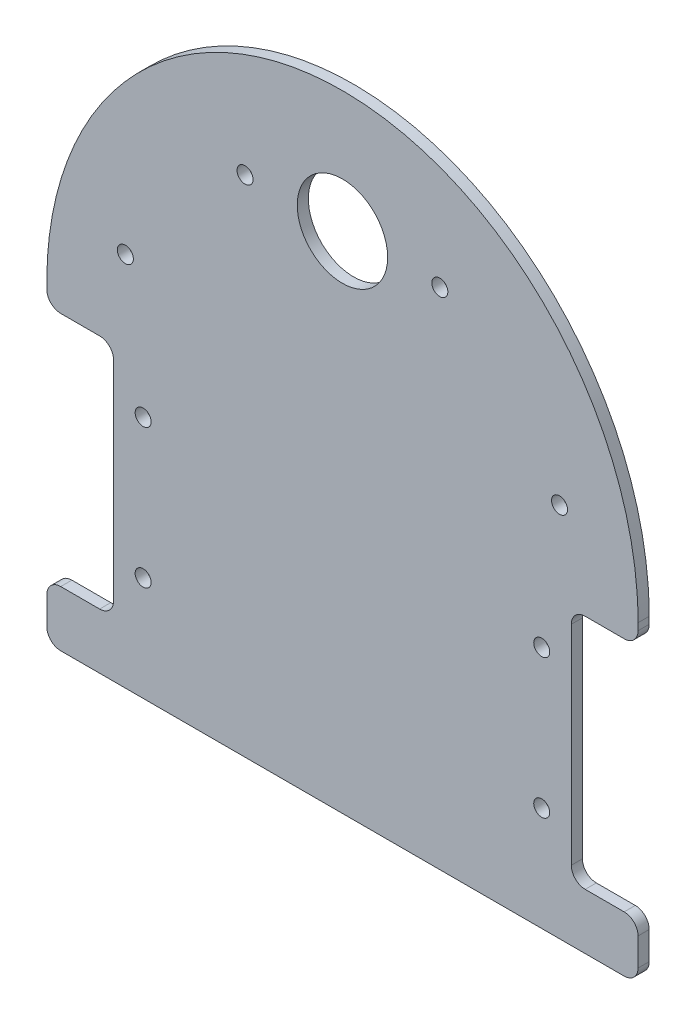
from build123d import *

# Parameters (mm, degrees)
SKETCH1_W           = 85
SKETCH1_H           = 90
BOSS_EXTRUDE1_DEPTH = 1.6
CUT_EXTRUDE1_DEPTH  = 62.917768048
SKETCH3_W           = 9.6
SKETCH3_H           = 34
CUT_EXTRUDE2_DEPTH  = 62.917768192
SKETCH4_R           = 6.5
CUT_EXTRUDE3_DEPTH  = 62.917768192
SKETCH5_R           = 1.15
CUT_EXTRUDE4_DEPTH  = 62.917768192
SKETCH6_R           = 1.15
CUT_EXTRUDE5_DEPTH  = 62.917768192
FILLET1_R           = 2
SKETCH7_R           = 1.15
CUT_EXTRUDE6_DEPTH  = 10


with BuildPart() as part:
    # Sketch1 → Boss-Extrude1 (new body)
    with BuildSketch(Plane.XY):
        Rectangle(SKETCH1_W, SKETCH1_H)
    extrude(amount=BOSS_EXTRUDE1_DEPTH)

    # Sketch2 → Cut-Extrude1 (cut, through all)
    with BuildSketch(Plane.XY.offset(1.6)):
        with BuildLine():
            Line((-42.5, 0), (-70, 0))
            Line((-70, 0), (-70, 70))
            Line((-70, 70), (70, 70))
            Line((70, 70), (70, 0))
            Line((70, 0), (42.5, 0))
            add(Edge.make_bspline(
                [(42.5, 0), (42.5, 45), (0, 45), (-42.5, 45), (-42.5, 0)],
                knots=[1.570796327, 1.570796327, 1.570796327, 3.141592654, 3.141592654, 4.71238898, 4.71238898, 4.71238898], degree=2, weights=[1, 0.707106781, 1, 0.707106781, 1]))
        make_face()
    extrude(amount=-CUT_EXTRUDE1_DEPTH, mode=Mode.SUBTRACT)

    # Sketch3 → Cut-Extrude2 (cut, through all)
    with BuildSketch(Plane.XY.offset(1.6)):
        with Locations((-37.7, -20)):
            Rectangle(SKETCH3_W, SKETCH3_H)
        with Locations((37.7, -20)):
            Rectangle(SKETCH3_W, SKETCH3_H)
    extrude(amount=-CUT_EXTRUDE2_DEPTH, mode=Mode.SUBTRACT)

    # Sketch4 → Cut-Extrude3 (cut, through all)
    with BuildSketch(Plane.XY.offset(1.6)):
        with Locations((0, 27.5)):
            Circle(SKETCH4_R)
    extrude(amount=-CUT_EXTRUDE3_DEPTH, mode=Mode.SUBTRACT)

    # Sketch5 → Cut-Extrude4 (cut, through all)
    with BuildSketch(Plane.XY.offset(1.6)):
        with Locations((-28.65, -10)):
            Circle(SKETCH5_R)
        with Locations((-28.65, -30)):
            Circle(SKETCH5_R)
        with Locations((28.65, -30)):
            Circle(SKETCH5_R)
        with Locations((28.65, -10)):
            Circle(SKETCH5_R)
    extrude(amount=-CUT_EXTRUDE4_DEPTH, mode=Mode.SUBTRACT)

    # Sketch6 → Cut-Extrude5 (cut, through all)
    with BuildSketch(Plane.XY.offset(1.6)):
        with Locations((-14, 27.5)):
            Circle(SKETCH6_R)
        with Locations((14, 27.5)):
            Circle(SKETCH6_R)
    extrude(amount=-CUT_EXTRUDE5_DEPTH, mode=Mode.SUBTRACT)

    # Fillet1
    fillet1_edges = [part.edges().sort_by_distance(p)[0] for p in [
        (42.5, -37, 0.8),
        (32.9, -37, 0.8),
        (32.9, -3, 0.8),
        (42.5, -3, 0.8),
        (-32.9, -37, 0.8),
        (-32.9, -3, 0.8),
        (-42.5, -37, 0.8),
        (-42.5, -3, 0.8),
        (42.5, -45, 0.8),
        (-42.5, -45, 0.8),
    ]]
    fillet(fillet1_edges, radius=FILLET1_R)

    # Sketch7 → Cut-Extrude6 (cut)
    with BuildSketch(Plane.XY.offset(1.6)):
        with Locations((-31.2085, 9)):
            Circle(SKETCH7_R)
        with Locations((31.2085, 9)):
            Circle(SKETCH7_R)
    extrude(amount=-CUT_EXTRUDE6_DEPTH, mode=Mode.SUBTRACT)


solid = part.part
